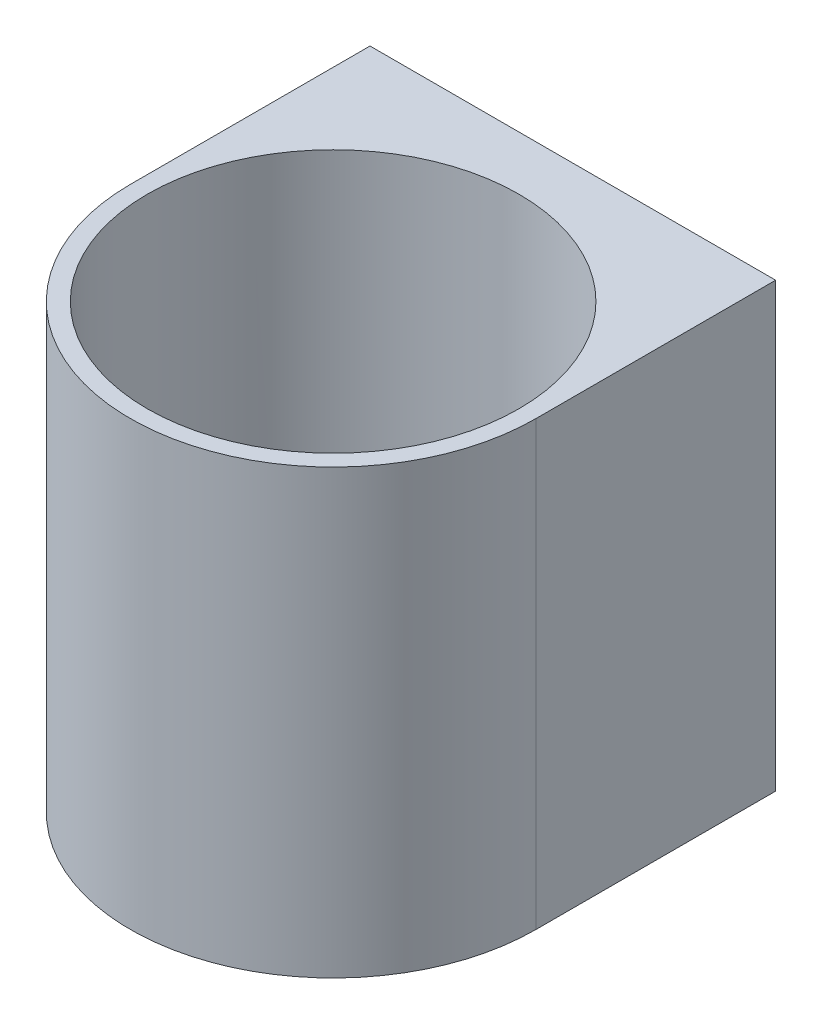
from build123d import *

# Parameters (mm, degrees)
SKETCH1_R           = 25.2
BOSS_EXTRUDE2_DEPTH = 60
SKETCH3_R           = 25.2
BOSS_EXTRUDE3_DEPTH = 9.3
SKETCH4_R           = 1.75
CUT_EXTRUDE1_DEPTH  = 81.850096247


with BuildPart() as part:
    # Sketch1 → Boss-Extrude2 (new body)
    with BuildSketch(Plane(origin=(0, 0, 0), x_dir=(1, 0, 0), z_dir=(0, 1, 0))):
        with BuildLine():
            Line((9.493421053, 16.463815789), (-45.506578947, 16.463815789))
            Line((-45.506578947, 16.463815789), (-45.506578947, -16.036184211))
            ThreePointArc((-45.506578947, -16.036184211), (-18.006578947, -43.536184211), (9.493421053, -16.036184211))
            Line((9.493421053, -16.036184211), (9.493421053, 16.463815789))
        make_face()
        with Locations((-18.006578947, -16.036184211)):
            Circle(SKETCH1_R, mode=Mode.SUBTRACT)
    extrude(amount=BOSS_EXTRUDE2_DEPTH)

    # Sketch3 → Boss-Extrude3 (add)
    with BuildSketch(Plane(origin=(0, 0, 0), x_dir=(-1, 0, 0), z_dir=(0, -1, 0))):
        with Locations((18.006578947, -16.036184211)):
            Circle(SKETCH3_R)
    extrude(amount=-BOSS_EXTRUDE3_DEPTH)

    # Sketch4 → Cut-Extrude1 (cut, through all)
    with BuildSketch(Plane(origin=(0, 9.3, 0), x_dir=(1, 0, 0), z_dir=(0, 1, 0))):
        with Locations((-18.006578947, -36.036184211)):
            Circle(SKETCH4_R)
        with Locations((-38.006578947, -16.036184211)):
            Circle(SKETCH4_R)
        with Locations((-33.04333339, -16.036184211)):
            Circle(SKETCH4_R)
        with Locations((-28.006578947, -16.036184211)):
            Circle(SKETCH4_R)
        with Locations((-23.006578947, -16.036184211)):
            Circle(SKETCH4_R)
        with Locations((-18.006578947, 3.963815789)):
            Circle(SKETCH4_R)
        with Locations((-18.006578947, -1.036184211)):
            Circle(SKETCH4_R)
        with Locations((-18.006578947, -6.036184211)):
            Circle(SKETCH4_R)
        with Locations((-18.006578947, -11.036184211)):
            Circle(SKETCH4_R)
        with Locations((1.993421053, -16.036184211)):
            Circle(SKETCH4_R)
        with Locations((-3.118703261, -16.036184211)):
            Circle(SKETCH4_R)
        with Locations((-8.006578947, -16.036184211)):
            Circle(SKETCH4_R)
        with Locations((-13.006578947, -16.036184211)):
            Circle(SKETCH4_R)
        with Locations((-18.006578947, -16.036184211)):
            Circle(SKETCH4_R)
        with Locations((-18.006578947, -21.036184211)):
            Circle(SKETCH4_R)
        with Locations((-18.006578947, -26.036184211)):
            Circle(SKETCH4_R)
        with Locations((-18.006578947, -31.036184211)):
            Circle(SKETCH4_R)
        with Locations((-28.006578947, -6.036184211)):
            Circle(SKETCH4_R)
        with Locations((-8.006578947, -6.036184211)):
            Circle(SKETCH4_R)
        with Locations((-8.006578947, -26.036184211)):
            Circle(SKETCH4_R)
        with Locations((-28.006578947, -26.036184211)):
            Circle(SKETCH4_R)
        with Locations((-23.006578947, -6.036184211)):
            Circle(SKETCH4_R)
        with Locations((-13.006578947, -6.036184211)):
            Circle(SKETCH4_R)
        with Locations((-13.006578947, -21.036184211)):
            Circle(SKETCH4_R)
        with Locations((-23.006578947, -21.036184211)):
            Circle(SKETCH4_R)
        with Locations((-28.006578947, -21.036184211)):
            Circle(SKETCH4_R)
        with Locations((-33.006578947, -21.036184211)):
            Circle(SKETCH4_R)
        with Locations((-23.006578947, -26.036184211)):
            Circle(SKETCH4_R)
        with Locations((-13.006578947, -26.036184211)):
            Circle(SKETCH4_R)
        with Locations((-13.006578947, -31.036184211)):
            Circle(SKETCH4_R)
        with Locations((-23.006578947, -31.036184211)):
            Circle(SKETCH4_R)
        with Locations((-8.006578947, -21.036184211)):
            Circle(SKETCH4_R)
        with Locations((-3.006578947, -21.036184211)):
            Circle(SKETCH4_R)
        with Locations((-23.006578947, -11.036184211)):
            Circle(SKETCH4_R)
        with Locations((-28.006578947, -11.036184211)):
            Circle(SKETCH4_R)
        with Locations((-33.006578947, -11.036184211)):
            Circle(SKETCH4_R)
        with Locations((-13.006578947, -11.036184211)):
            Circle(SKETCH4_R)
        with Locations((-8.006578947, -11.036184211)):
            Circle(SKETCH4_R)
        with Locations((-3.006578947, -11.036184211)):
            Circle(SKETCH4_R)
        with Locations((-23.006578947, -1.036184211)):
            Circle(SKETCH4_R)
        with Locations((-13.006578947, -1.036184211)):
            Circle(SKETCH4_R)
    extrude(amount=-CUT_EXTRUDE1_DEPTH, mode=Mode.SUBTRACT)


solid = part.part
